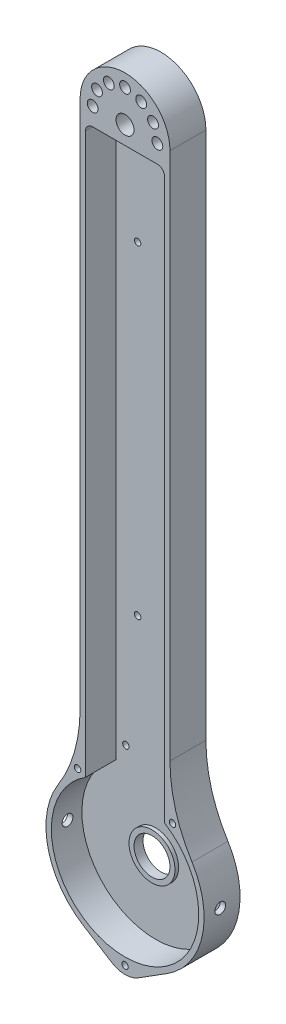
from build123d import *

# Parameters (mm, degrees)
SKETCH1_R               = 6.35
SKETCH1_R_2             = 3.175
BOSS_EXTRUDE1_DEPTH     = 12.7
CUT_EXTRUDE1_DEPTH      = 10.795
CUT_EXTRUDE2_DEPTH      = 247.165512308
CUT_EXTRUDE2_DEPTH_BACK = 247.165512308
F_3DSKETCH2_R           = 1.905
SKETCH3_R               = 8.128
SKETCH3_R_2             = 6.35
BOSS_EXTRUDE2_DEPTH     = 1.27
SKETCH4_R               = 1.5875
SKETCH4_R_2             = 1.143
CUT_EXTRUDE3_DEPTH      = 31.75
SKETCH5_R               = 1.905
CUT_EXTRUDE4_DEPTH      = 7.62
SKETCH6_W               = 3.175
SKETCH6_H               = 7.353822806
CUT_EXTRUDE5_DEPTH      = 1.016
SKETCH7_R               = 4.445
CUT_EXTRUDE6_DEPTH      = 1.27


with BuildPart() as part:
    # Sketch1 → Boss-Extrude1 (new body)
    with BuildSketch(Plane.XY):
        with BuildLine():
            Line((-15.875, 228.6), (-15.875, 41.885940063))
            ThreePointArc((-15.875, 41.885940063), (-17.859739298, 27.82498979), (-23.658870968, 14.862752926))
            ThreePointArc((-23.658870968, 14.862752926), (-27.242520167, -6.203925768), (-14.890307558, -23.641538462))
            Line((-14.890307558, -23.641538462), (-4.737825132, -30.035944056))
            ThreePointArc((-4.737825132, -30.035944056), (0, -31.403636364), (4.737825132, -30.035944056))
            Line((4.737825132, -30.035944056), (14.890307558, -23.641538462))
            ThreePointArc((14.890307558, -23.641538462), (27.242520167, -6.203925768), (23.658870968, 14.862752926))
            ThreePointArc((23.658870968, 14.862752926), (17.859739298, 27.82498979), (15.875, 41.885940063))
            Line((15.875, 41.885940063), (15.875, 228.6))
            ThreePointArc((15.875, 228.6), (0, 244.475), (-15.875, 228.6))
        make_face()
        Circle(SKETCH1_R, mode=Mode.SUBTRACT)
        with Locations((0, 228.6)):
            Circle(SKETCH1_R_2, mode=Mode.SUBTRACT)
    extrude(amount=BOSS_EXTRUDE1_DEPTH)

    # Sketch2 → Cut-Extrude1 (cut)
    with BuildSketch(Plane.XY.offset(12.7)):
        with BuildLine():
            Line((-11.43, 222.25), (11.43, 222.25))
            ThreePointArc((11.43, 222.25), (13.226051224, 221.506051224), (13.97, 219.71))
            Line((13.97, 219.71), (13.97, 21.969531743))
            ThreePointArc((13.97, 21.969531743), (0, -26.035), (-13.97, 21.969531743))
            Line((-13.97, 21.969531743), (-13.97, 219.71))
            ThreePointArc((-13.97, 219.71), (-13.226051224, 221.506051224), (-11.43, 222.25))
        make_face()
    extrude(amount=-CUT_EXTRUDE1_DEPTH, mode=Mode.SUBTRACT)

    # 3DSketch2 → Cut-Extrude2 (cut, two sides: drawn at the far end of the back side and taken through both)
    with BuildSketch(Plane(origin=(0, 0, 6.985), x_dir=(0, 0, -1), z_dir=(-1, 0, 0)).offset(-CUT_EXTRUDE2_DEPTH_BACK)):
        Circle(F_3DSKETCH2_R)
    extrude(amount=CUT_EXTRUDE2_DEPTH + CUT_EXTRUDE2_DEPTH_BACK, mode=Mode.SUBTRACT)

    # Sketch3 → Boss-Extrude2 (add)
    with BuildSketch(Plane.XY.offset(1.905)):
        Circle(SKETCH3_R)
        Circle(SKETCH3_R_2, mode=Mode.SUBTRACT)
    extrude(amount=BOSS_EXTRUDE2_DEPTH)

    # Sketch4 → Cut-Extrude3 (cut)
    with BuildSketch(Plane.XY.offset(12.7)):
        with Locations((0, 219.71)):
            Circle(SKETCH4_R)
        with Locations((-6.35, 184.15)):
            Circle(SKETCH4_R_2)
        with Locations((6.35, 184.15)):
            Circle(SKETCH4_R_2)
        with Locations((-6.35, 69.85)):
            Circle(SKETCH4_R_2)
        with Locations((6.35, 69.85)):
            Circle(SKETCH4_R_2)
        with Locations((-16.764, 23.241)):
            Circle(SKETCH4_R_2)
        with Locations((16.764, 23.241)):
            Circle(SKETCH4_R_2)
        with Locations((0, -28.575)):
            Circle(SKETCH4_R_2)
        with Locations((-10.4775, 28.1178)):
            Circle(SKETCH4_R_2)
        with Locations((10.4775, 28.1178)):
            Circle(SKETCH4_R_2)
    extrude(amount=-CUT_EXTRUDE3_DEPTH, mode=Mode.SUBTRACT)

    # Sketch5 → Cut-Extrude4 (cut)
    with BuildSketch(Plane.XY.offset(12.7)):
        with Locations((-11.43, 228.6)):
            Circle(SKETCH5_R)
        with Locations((-9.898670365, 234.315)):
            Circle(SKETCH5_R)
        with Locations((-5.715, 238.498670365)):
            Circle(SKETCH5_R)
        with Locations((0, 240.03)):
            Circle(SKETCH5_R)
        with Locations((5.715, 238.498670365)):
            Circle(SKETCH5_R)
        with Locations((9.898670365, 234.315)):
            Circle(SKETCH5_R)
        with Locations((11.43, 228.6)):
            Circle(SKETCH5_R)
    extrude(amount=-CUT_EXTRUDE4_DEPTH, mode=Mode.SUBTRACT)

    # Sketch6 → Cut-Extrude5 (cut)
    with BuildSketch(Plane(origin=(0, 0, 0), x_dir=(-1, 0, 0), z_dir=(0, 0, -1))):
        with Locations((0, 223.386911403)):
            Rectangle(SKETCH6_W, SKETCH6_H)
    extrude(amount=-CUT_EXTRUDE5_DEPTH, mode=Mode.SUBTRACT)

    # Sketch7 → Cut-Extrude6 (cut)
    with BuildSketch(Plane(origin=(0, 0, 0), x_dir=(-1, 0, 0), z_dir=(0, 0, -1))):
        with Locations((0, 228.6)):
            Circle(SKETCH7_R)
    extrude(amount=-CUT_EXTRUDE6_DEPTH, mode=Mode.SUBTRACT)


solid = part.part
